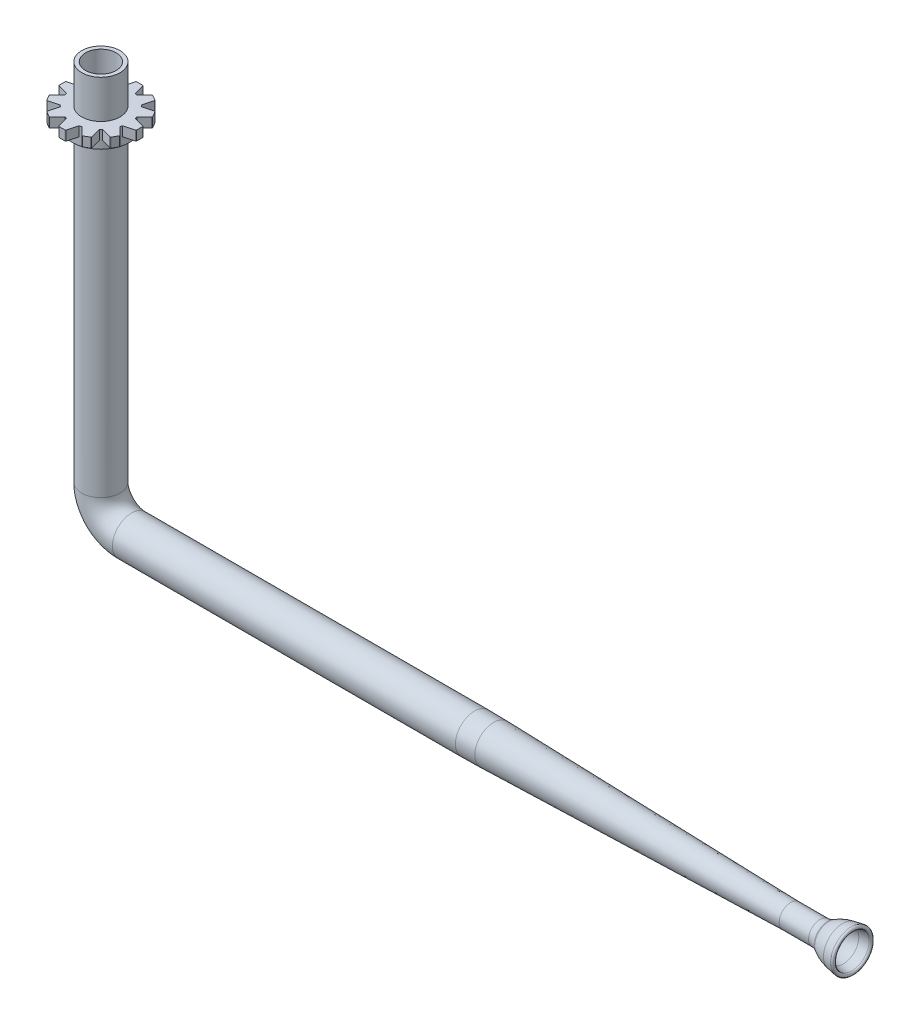
from build123d import *
from build123d.topology import SkipClean

# Parameters (mm, degrees)
SKETCH1_R                = 7.5
BOSS_EXTRUDE1_DEPTH      = 2.5
BOSS_EXTRUDE2_DEPTH      = 10
BOSS_EXTRUDE2_DEPTH_BACK = 83
SKETCH2_R                = 5
SKETCH2_R_2              = 4
BOSS_EXTRUDE3_DEPTH      = 2.5
FILLET1_R                = 0.125
CIRPATTERN1_COUNT        = 12
FILLET1_OF_CIRPATTERN1_R = 0.125
SKETCH4_R                = 4
CUT_EXTRUDE1_DEPTH       = 2.5
SKETCH5_R                = 5
SKETCH5_R_2              = 4
FILLET2_R                = 200
SKETCH8_R                = 3
SKETCH8_R_2              = 2
BOSS_EXTRUDE4_DEPTH      = 5
BOSS_EXTRUDE5_START      = 2
SKETCH10_R               = 7.5
SKETCH10_R_2             = 5
BOSS_EXTRUDE5_DEPTH      = 2


with BuildPart() as part:
    # Sketch1 → Boss-Extrude1 (new body)
    with BuildSketch(Plane(origin=(0, 0, 0), x_dir=(1, 0, 0), z_dir=(0, 1, 0))):
        with Locations(Location((0, 0, 0), (0, 0, 270))):
            Circle(SKETCH1_R)
    extrude(amount=BOSS_EXTRUDE1_DEPTH)

    # Sketch2 → Boss-Extrude2 (add, two sides: drawn at the far end of the back side and taken through both)
    with BuildSketch(Plane(origin=(0, 2.5, 0), x_dir=(1, 0, 0), z_dir=(0, 1, 0)).offset(-BOSS_EXTRUDE2_DEPTH_BACK)):
        with Locations(Location((0, 0, 0), (0, 0, 270))):
            Circle(SKETCH2_R)
        with Locations(Location((0, 0, 0), (0, 0, 270))):
            Circle(SKETCH2_R_2, mode=Mode.SUBTRACT)
    extrude(amount=BOSS_EXTRUDE2_DEPTH + BOSS_EXTRUDE2_DEPTH_BACK)

    # Sketch3 → Boss-Extrude3 (add)
    with BuildSketch(Plane.XZ):
        Polygon((0, 10.119615242), (0.9, 10.119615242), (1.682308546, 7.2), (-1.682308546, 7.2), (-0.9, 10.119615242), align=None)
    boss_extrude3 = extrude(amount=-BOSS_EXTRUDE3_DEPTH)

    # Fillet1
    fillet1_edges = [part.edges().sort_by_distance(p)[0] for p in [
        (0.9, 1.25, 10.119615242),
        (-0.9, 1.25, 10.119615242),
    ]]
    fillet(fillet1_edges, radius=FILLET1_R)

    # CirPattern1: Boss-Extrude3 ×12 about axis
    cirpattern1_axis = Axis((0, 0, 0), (0, 1, 0))
    for i in range(1, CIRPATTERN1_COUNT):
        add(boss_extrude3.rotate(cirpattern1_axis, i * 360 / CIRPATTERN1_COUNT))

    # Fillet1 of CirPattern1
    fillet1_of_cirpattern1_edges = [part.edges().sort_by_distance(p)[0] for p in [
        (5.839230485, 1.25, 8.313843876),
        (4.280384758, 1.25, 9.213843876),
        (9.213843876, 1.25, 4.280384758),
        (8.313843876, 1.25, 5.839230485),
        (10.119615242, 1.25, -0.9),
        (10.119615242, 1.25, 0.9),
        (8.313843876, 1.25, -5.839230485),
        (9.213843876, 1.25, -4.280384758),
        (4.280384758, 1.25, -9.213843876),
        (5.839230485, 1.25, -8.313843876),
        (-0.9, 1.25, -10.119615242),
        (0.9, 1.25, -10.119615242),
        (-5.839230485, 1.25, -8.313843876),
        (-4.280384758, 1.25, -9.213843876),
        (-9.213843876, 1.25, -4.280384758),
        (-8.313843876, 1.25, -5.839230485),
        (-10.119615242, 1.25, 0.9),
        (-10.119615242, 1.25, -0.9),
        (-8.313843876, 1.25, 5.839230485),
        (-9.213843876, 1.25, 4.280384758),
        (-4.280384758, 1.25, 9.213843876),
        (-5.839230485, 1.25, 8.313843876),
    ]]
    fillet(fillet1_of_cirpattern1_edges, radius=FILLET1_OF_CIRPATTERN1_R)

    # Sketch4 → Cut-Extrude1 (cut)
    with BuildSketch(Plane(origin=(0, 2.5, 0), x_dir=(1, 0, 0), z_dir=(0, 1, 0))):
        with Locations(Location((0, 0, 0), (0, 0, 270))):
            Circle(SKETCH4_R)
    extrude(amount=-CUT_EXTRUDE1_DEPTH, mode=Mode.SUBTRACT)

    # Sweep3: sweep along a path in Sketch6
    with BuildLine(Plane.XY) as sweep3_path:
        Line((0, -80.5), (0, -82.5))
        ThreePointArc((0, -82.5), (2.343145751, -88.156854249), (8, -90.5))
        Line((8, -90.5), (100, -90.5))
    # Sketch5 → Sweep3 (sweep)
    with BuildSketch(Plane.XZ.offset(80.5)):
        Circle(SKETCH5_R)
        Circle(SKETCH5_R_2, mode=Mode.SUBTRACT)
    sweep(path=sweep3_path.line)

    # Sketch7 → Revolve1 (revolve)
    with BuildSketch(Plane.XY, mode=Mode.PRIVATE) as revolve1_sk:
        Polygon((180, -88.5), (100, -86.5), (100, -85.5), (180, -87.5), align=None)
    revolve(revolve1_sk.sketch.rotate(Axis((100, -90.5, 0), (1, 0, 0)), 270), axis=Axis((100, -90.5, 0), (1, 0, 0)))

    # Fillet2
    # the kernel refuses this fillet: 200 mm, written as the material it takes off along each edge
    with BuildSketch(Plane(origin=(100, -90.5, 0), x_dir=(0, 1, 0), z_dir=(0, 0, -1))) as fillet2_piece_1:
        with BuildLine():
            CenterArc((5 - FILLET2_R, -FILLET2_R * 0.0124980474851), FILLET2_R, 0, 1.432096184)
            Line((5 - FILLET2_R * 0.000312353591877, FILLET2_R * 0.0124941436751), (5, 0))
            Line((5, 0), (5, -FILLET2_R * 0.0124980474851))
        make_face()
    revolve(axis=Axis((100, -90.5, 0), (1, 0, 0)), revolution_arc=270, mode=Mode.SUBTRACT)
    with BuildSketch(Plane(origin=(100, -90.5, 0), x_dir=(0, 0, -1), z_dir=(0, -1, 0))) as fillet2_piece_2:
        with BuildLine():
            CenterArc((5 - FILLET2_R, -FILLET2_R * 0.0124980474851), FILLET2_R, 0, 1.432096184)
            Line((5 - FILLET2_R * 0.000312353591877, FILLET2_R * 0.0124941436751), (5, 0))
            Line((5, 0), (5, -FILLET2_R * 0.0124980474851))
        make_face()
    revolve(axis=Axis((100, -90.5, 0), (1, 0, 0)), revolution_arc=90, mode=Mode.SUBTRACT)

    # Sketch8 → Boss-Extrude4 (add)
    with BuildSketch(Plane(origin=(180, 0, 0), x_dir=(0, 0, -1), z_dir=(1, 0, 0))):
        with Locations(Location((0, -90.5, 0), (0, 0, 90))):
            Circle(SKETCH8_R)
        with Locations(Location((0, -90.5, 0), (0, 0, 180))):
            Circle(SKETCH8_R_2, mode=Mode.SUBTRACT)
    extrude(amount=BOSS_EXTRUDE4_DEPTH)

    # Sketch9 → Revolve2 (revolve)
    with BuildSketch(Plane.XY, mode=Mode.PRIVATE) as revolve2_sk:
        with BuildLine():
            Line((185, -88.5), (187.660254038, -88.5))
            ThreePointArc((187.660254038, -88.5), (188.954349263, -88.329629131), (190.160254038, -87.830127019))
            Line((190.160254038, -87.830127019), (190.472963553, -87.649584096))
            ThreePointArc((190.472963553, -87.649584096), (192.05276212, -86.912911926), (193.736481777, -86.461760604))
            Line((193.736481777, -86.461760604), (196, -86.06264127))
            ThreePointArc((196, -86.06264127), (196.405579788, -85.483413304), (195.826351822, -85.077833517))
            Line((195.826351822, -85.077833517), (193.562833599, -85.476952851))
            ThreePointArc((193.562833599, -85.476952851), (191.710741977, -85.973219305), (189.972963553, -86.783558692))
            Line((189.972963553, -86.783558692), (189.660254038, -86.964101615))
            ThreePointArc((189.660254038, -86.964101615), (188.695530218, -87.363703305), (187.660254038, -87.5))
            Line((187.660254038, -87.5), (185, -87.5))
            Line((185, -87.5), (185, -88.5))
        make_face()
    revolve(revolve2_sk.sketch.rotate(Axis((185, -90.5, 0), (1, 0, 0)), 90), axis=Axis((185, -90.5, 0), (1, 0, 0)))

    # Sketch10 → Boss-Extrude5 (add)
    with SkipClean():  # the faces are left unmerged after this step: merging them gives an invalid solid
        with BuildSketch(Plane.XZ.offset(BOSS_EXTRUDE5_START)):
            with Locations(Location((0, 0, 0), (0, 0, 270))):
                Circle(SKETCH10_R)
            with Locations(Location((0, 0, 0), (0, 0, 180))):
                Circle(SKETCH10_R_2, mode=Mode.SUBTRACT)
        extrude(amount=-BOSS_EXTRUDE5_DEPTH)
    add(part.part.scale(1), mode=Mode.REPLACE)  # the faces are merged on a copy


solid = part.part
